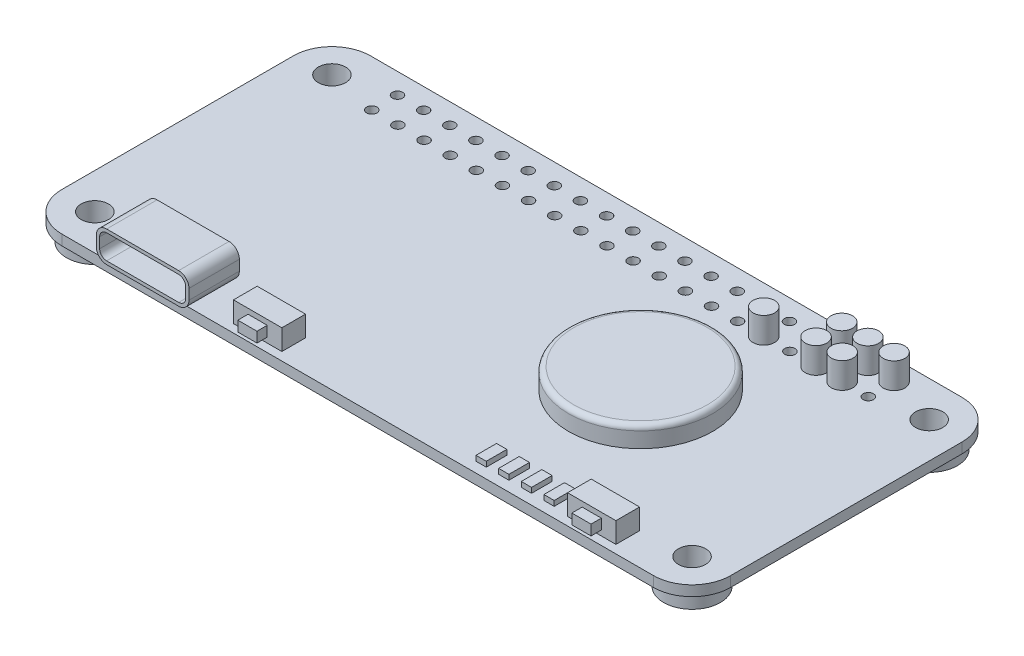
from build123d import *

# Parameters (mm, degrees)
BOSS_EXTRUDE1_DEPTH      = 1
SKETCH2_R                = 1.325
CUT_EXTRUDE1_DEPTH       = 36.80851854
SKETCH3_R                = 0.5
CUT_EXTRUDE2_DEPTH       = 36.80851854
LPATTERN1_COUNT          = 20
LPATTERN1_PITCH          = 2.54
BOSS_EXTRUDE6_DEPTH      = 0.4
BOSS_EXTRUDE6_DEPTH_BACK = 4.5
CUT_EXTRUDE9_DEPTH       = 5.25
SKETCH_1_W               = 4.7
SKETCH_1_H               = 2.3
EXTRUDE_1_DEPTH          = 2
SKETCH_2_W               = 1.86
SKETCH_2_H               = 1
EXTRUDE_2_DEPTH          = 1
SKETCH_9_R               = 2.75
SKETCH_9_R_2             = 1.325
EXTRUDE_8_DEPTH          = 1.5
SKETCH_10_R              = 1.05
EXTRUDE_9_DEPTH          = 2.5
SKETCH_11_R              = 0.5
EXTRUDE_10_DEPTH         = 3
SKETCH_12_R              = 7
EXTRUDE_11_DEPTH         = 2
SKETCH_13_W              = 1
SKETCH_13_H              = 2
EXTRUDE_12_DEPTH         = 0.5
FILLET_1_R               = 0.5
EXTRUDE_13_DEPTH         = 1


with BuildPart() as part:
    # Sketch1 → Boss-Extrude1 (new body)
    with BuildSketch(Plane(origin=(0, 0, 0), x_dir=(1, 0, 0), z_dir=(0, 1, 0))):
        with BuildLine():
            Line((-28.75, 15), (28.75, 15))
            ThreePointArc((28.75, 15), (31.401650429, 13.901650429), (32.5, 11.25))
            Line((32.5, 11.25), (32.5, -11.25))
            ThreePointArc((32.5, -11.25), (31.401650429, -13.901650429), (28.75, -15))
            Line((28.75, -15), (-28.75, -15))
            ThreePointArc((-28.75, -15), (-31.401650429, -13.901650429), (-32.5, -11.25))
            Line((-32.5, -11.25), (-32.5, 11.25))
            ThreePointArc((-32.5, 11.25), (-31.401650429, 13.901650429), (-28.75, 15))
        make_face()
    extrude(amount=BOSS_EXTRUDE1_DEPTH)

    # Sketch2 → Cut-Extrude1 (cut, through all)
    with BuildSketch(Plane(origin=(0, 1, 0), x_dir=(1, 0, 0), z_dir=(0, 1, 0))):
        with Locations((-29.025, 11.525)):
            Circle(SKETCH2_R)
        with Locations((29.025, 11.525)):
            Circle(SKETCH2_R)
        with Locations((29.025, -11.525)):
            Circle(SKETCH2_R)
        with Locations((-29.025, -11.525)):
            Circle(SKETCH2_R)
    extrude(amount=-CUT_EXTRUDE1_DEPTH, mode=Mode.SUBTRACT)

    # Sketch3 → Cut-Extrude2 (cut, through all)
    with BuildSketch(Plane(origin=(0, 1, 0), x_dir=(1, 0, 0), z_dir=(0, 1, 0))):
        with Locations((-24.128, 13)):
            Circle(SKETCH3_R)
        with Locations((-24.128, 10.5)):
            Circle(SKETCH3_R)
    cut_extrude2 = extrude(amount=-CUT_EXTRUDE2_DEPTH, mode=Mode.SUBTRACT)

    # LPattern1: Cut-Extrude2 ×20
    with Locations(*[(i * LPATTERN1_PITCH, 0, 0) for i in range(1, LPATTERN1_COUNT)]):
        add(cut_extrude2, mode=Mode.SUBTRACT)

    # Sketch15 → Boss-Extrude6 (add, two sides: drawn at the far end of the back side and taken through both)
    with BuildSketch(Plane.XY.offset(15).offset(-BOSS_EXTRUDE6_DEPTH_BACK)):
        with BuildLine():
            Line((-24, 4), (-17, 4))
            ThreePointArc((-17, 4), (-16.292893219, 3.707106781), (-16, 3))
            Line((-16, 3), (-16, 2))
            ThreePointArc((-16, 2), (-16.292893219, 1.292893219), (-17, 1))
            Line((-17, 1), (-24, 1))
            ThreePointArc((-24, 1), (-24.707106781, 1.292893219), (-25, 2))
            Line((-25, 2), (-25, 3))
            ThreePointArc((-25, 3), (-24.707106781, 3.707106781), (-24, 4))
        make_face()
    extrude(amount=BOSS_EXTRUDE6_DEPTH + BOSS_EXTRUDE6_DEPTH_BACK)

    # Sketch16 → Cut-Extrude9 (cut)
    with BuildSketch(Plane.XY.offset(15.4)):
        with BuildLine():
            Line((-17, 3.68), (-24, 3.68))
            ThreePointArc((-24, 3.68), (-24.480832611, 3.480832611), (-24.68, 3))
            Line((-24.68, 3), (-24.68, 2))
            ThreePointArc((-24.68, 2), (-24.480832611, 1.519167389), (-24, 1.32))
            Line((-24, 1.32), (-17, 1.32))
            ThreePointArc((-17, 1.32), (-16.519167389, 1.519167389), (-16.32, 2))
            Line((-16.32, 2), (-16.32, 3))
            ThreePointArc((-16.32, 3), (-16.519167389, 3.480832611), (-17, 3.68))
        make_face()
    extrude(amount=-CUT_EXTRUDE9_DEPTH, mode=Mode.SUBTRACT)

    # 草图1 → 凸台-拉伸1 (add)
    with BuildSketch(Plane(origin=(0, 1, 0), x_dir=(1, 0, 0), z_dir=(0, 1, 0))):
        with Locations((-10.52, -13.05)):
            Rectangle(SKETCH_1_W, SKETCH_1_H)
        with Locations((21.95, -13.05)):
            Rectangle(SKETCH_1_W, SKETCH_1_H)
    extrude(amount=EXTRUDE_1_DEPTH)

    # 草图2 → 凸台-拉伸2 (add)
    with BuildSketch(Plane.XY.offset(14.2)):
        with Locations((-10.52, 2)):
            Rectangle(SKETCH_2_W, SKETCH_2_H)
        with Locations((21.95, 2)):
            Rectangle(SKETCH_2_W, SKETCH_2_H)
    extrude(amount=EXTRUDE_2_DEPTH)

    # 草图9 → 凸台-拉伸8 (add)
    # profile 1 of 4: a face of its own
    with BuildSketch(Plane.XZ):
        with Locations((29.025, 11.525)):
            Circle(SKETCH_9_R)
        with Locations((29.025, 11.525)):
            Circle(SKETCH_9_R_2, mode=Mode.SUBTRACT)
    # profile 2 of 4: a face of its own
    with BuildSketch(Plane.XZ):
        with Locations((29.025, -11.525)):
            Circle(SKETCH_9_R)
        with Locations((29.025, -11.525)):
            Circle(SKETCH_9_R_2, mode=Mode.SUBTRACT)
    # profile 3 of 4: a face of its own
    with BuildSketch(Plane.XZ):
        with Locations((-29.025, 11.525)):
            Circle(SKETCH_9_R)
        with Locations((-29.025, 11.525)):
            Circle(SKETCH_9_R_2, mode=Mode.SUBTRACT)
    # profile 4 of 4: a face of its own
    with BuildSketch(Plane.XZ):
        with Locations((-29.025, -11.525)):
            Circle(SKETCH_9_R)
        with Locations((-29.025, -11.525)):
            Circle(SKETCH_9_R_2, mode=Mode.SUBTRACT)
    extrude(amount=EXTRUDE_8_DEPTH)

    # 草图10 → 凸台-拉伸9 (add)
    with BuildSketch(Plane(origin=(0, 1, 0), x_dir=(1, 0, 0), z_dir=(0, 1, 0))):
        with Locations((24.132, 13)):
            Circle(SKETCH_10_R)
        with Locations((21.592, 13)):
            Circle(SKETCH_10_R)
        with Locations((19.052, 13)):
            Circle(SKETCH_10_R)
        with Locations((21.592, 10.5)):
            Circle(SKETCH_10_R)
        with Locations((19.052, 10.5)):
            Circle(SKETCH_10_R)
        with Locations((13.972, 10.5)):
            Circle(SKETCH_10_R)
    extrude(amount=EXTRUDE_9_DEPTH)

    # 草图11 → 凸台-拉伸10 (add)
    with BuildSketch(Plane.XZ.offset(-1)):
        with Locations((24.132, -13)):
            Circle(SKETCH_11_R)
        with Locations((21.592, -13)):
            Circle(SKETCH_11_R)
        with Locations((21.592, -10.5)):
            Circle(SKETCH_11_R)
        with Locations((19.052, -10.5)):
            Circle(SKETCH_11_R)
        with Locations((19.052, -13)):
            Circle(SKETCH_11_R)
        with Locations((13.972, -10.5)):
            Circle(SKETCH_11_R)
    extrude(amount=EXTRUDE_10_DEPTH)

    # 草图12 → 凸台-拉伸11 (add)
    with BuildSketch(Plane(origin=(0, 1, 0), x_dir=(1, 0, 0), z_dir=(0, 1, 0))):
        with Locations((12.5, 0)):
            Circle(SKETCH_12_R)
    extrude(amount=EXTRUDE_11_DEPTH)

    # 草图13 → 凸台-拉伸12 (add)
    with BuildSketch(Plane(origin=(0, 1, 0), x_dir=(1, 0, 0), z_dir=(0, 1, 0))):
        with Locations((17.6, -13)):
            Rectangle(SKETCH_13_W, SKETCH_13_H)
        with Locations((15.4, -13)):
            Rectangle(SKETCH_13_W, SKETCH_13_H)
        with Locations((13.2, -13)):
            Rectangle(SKETCH_13_W, SKETCH_13_H)
        with Locations((11, -13)):
            Rectangle(SKETCH_13_W, SKETCH_13_H)
    extrude(amount=EXTRUDE_12_DEPTH)

    # 圆角1
    fillet_1_edges = [part.edges().sort_by_distance(p)[0] for p in [
        (5.5, 3, 0),
    ]]
    fillet(fillet_1_edges, radius=FILLET_1_R)

    # 草图14 → 凸台-拉伸13 (add)
    with BuildSketch(Plane(origin=(0, 0, 10.5), x_dir=(-1, 0, 0), z_dir=(0, 0, -1))):
        with BuildLine():
            Line((16, 3), (16, 2))
            ThreePointArc((16, 2), (16.292893219, 1.292893219), (17, 1))
            Line((17, 1), (24, 1))
            ThreePointArc((24, 1), (24.707106781, 1.292893219), (25, 2))
            Line((25, 2), (25, 3))
            ThreePointArc((25, 3), (24.707106781, 3.707106781), (24, 4))
            Line((24, 4), (17, 4))
            ThreePointArc((17, 4), (16.292893219, 3.707106781), (16, 3))
        make_face()
    extrude(amount=-EXTRUDE_13_DEPTH)


solid = part.part
